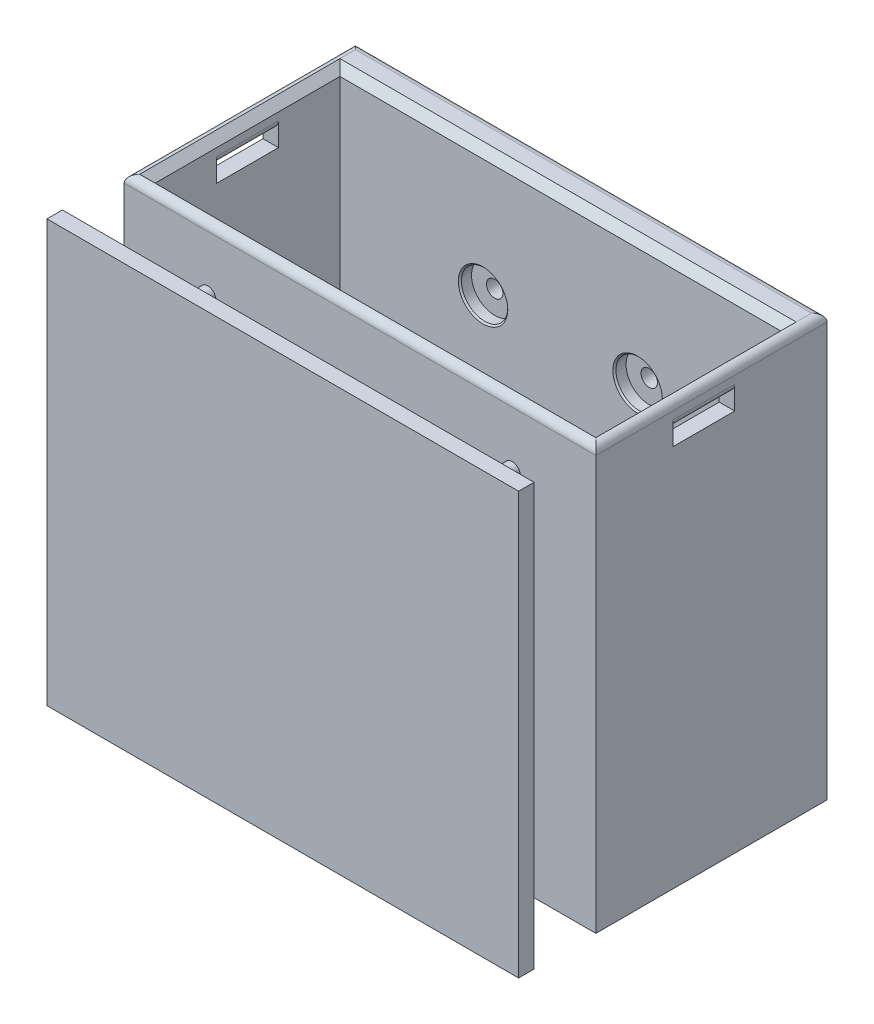
from build123d import *

# Parameters (mm, degrees)
SKETCH2_W                               = 193.802
SKETCH2_H                               = 94.996
BOSS_EXTRUDE1_DEPTH                     = 6.35
BOSS_EXTRUDE2_START                     = 6.35
SKETCH2_3_W                             = 193.802
SKETCH2_3_H                             = 94.996
SKETCH2_3_W_2                           = 181.102
SKETCH2_3_H_2                           = 75.946
BOSS_EXTRUDE2_DEPTH                     = 166.878
CBORE_FOR_1_4_HEX_HEAD_BOLT2_AT_2_COUNT = 2
CBORE_FOR_1_4_HEX_HEAD_BOLT2_AT_2_PITCH = 63.5
CBORE_FOR_1_4_HEX_HEAD_BOLT2_AT_3_COUNT = 2
CBORE_FOR_1_4_HEX_HEAD_BOLT2_AT_3_PITCH = 89.802561211
CBORE_FOR_1_4_HEX_HEAD_BOLT2_AT_4_COUNT = 2
CBORE_FOR_1_4_HEX_HEAD_BOLT2_AT_4_PITCH = 63.5
SKETCH12_R                              = 3.302
BOSS_EXTRUDE3_DEPTH                     = 25.4
BOSS_EXTRUDE3_2_DEPTH                   = 25.4
BOSS_EXTRUDE3_3_DEPTH                   = 25.4
BOSS_EXTRUDE3_4_DEPTH                   = 25.4
BOSS_EXTRUDE4_START                     = 25.4
SKETCH13_W                              = 193.802
SKETCH13_H                              = 173.228
BOSS_EXTRUDE4_DEPTH                     = 6.35
SKETCH16_W                              = 25.4
SKETCH16_H                              = 6.35
CUT_EXTRUDE2_DEPTH                      = 271.839909387
FILLET1_R                               = 3.175
FILLET2_R                               = 3.175
CHAMFER1_SIZE                           = 3.175


with BuildPart() as part:
    # Sketch2 → Boss-Extrude1 (new body)
    with BuildSketch(Plane(origin=(0, 0, 0), x_dir=(1, 0, 0), z_dir=(0, 1, 0))):
        with Locations((0, 3.175)):
            Rectangle(SKETCH2_W, SKETCH2_H)
    extrude(amount=BOSS_EXTRUDE1_DEPTH)

    # Sketch2<3> → Boss-Extrude2 (add)
    with BuildSketch(Plane(origin=(0, 0, 0), x_dir=(1, 0, 0), z_dir=(0, 1, 0)).offset(BOSS_EXTRUDE2_START)):
        with Locations((0, 3.175)):
            Rectangle(SKETCH2_3_W, SKETCH2_3_H)
        Rectangle(SKETCH2_3_W_2, SKETCH2_3_H_2, mode=Mode.SUBTRACT)
    extrude(amount=BOSS_EXTRUDE2_DEPTH)

    # Sketch8 → CBORE for 1/4 Hex Head Bolt2 (revolve, cut)
    with BuildSketch(Plane(origin=(-31.75, 121.539, -37.973), x_dir=(0, -1, 0), z_dir=(1, 0, 0))):
        Polygon((0, 0), (0, 12.7), (3.3782, 12.7), (3.3782, 4.7752), (9.525, 4.7752), (9.525, 0.635), (10.16, 0), align=None)
    cbore_for_1_4_hex_head_bolt2 = revolve(axis=Axis((-31.75, 121.539, -31.623), (0, 0, -1)), mode=Mode.SUBTRACT)

    # CBORE for 1/4 Hex Head Bolt2 at 2: CBORE for 1/4 Hex Head Bolt2 ×2
    with Locations(*[(i * CBORE_FOR_1_4_HEX_HEAD_BOLT2_AT_2_PITCH, 0, 0) for i in range(1, CBORE_FOR_1_4_HEX_HEAD_BOLT2_AT_2_COUNT)]):
        add(cbore_for_1_4_hex_head_bolt2, mode=Mode.SUBTRACT)

    # CBORE for 1/4 Hex Head Bolt2 at 3: CBORE for 1/4 Hex Head Bolt2 ×2
    with Locations(*[Vector(0.7071067811865476, -0.7071067811865475, 0) * (i * CBORE_FOR_1_4_HEX_HEAD_BOLT2_AT_3_PITCH) for i in range(1, CBORE_FOR_1_4_HEX_HEAD_BOLT2_AT_3_COUNT)]):
        add(cbore_for_1_4_hex_head_bolt2, mode=Mode.SUBTRACT)

    # CBORE for 1/4 Hex Head Bolt2 at 4: CBORE for 1/4 Hex Head Bolt2 ×2
    with Locations(*[(0, -i * CBORE_FOR_1_4_HEX_HEAD_BOLT2_AT_4_PITCH, 0) for i in range(1, CBORE_FOR_1_4_HEX_HEAD_BOLT2_AT_4_COUNT)]):
        add(cbore_for_1_4_hex_head_bolt2, mode=Mode.SUBTRACT)

    # Sketch16 → Cut-Extrude2 (cut, through all)
    with BuildSketch(Plane(origin=(96.901, 0, 0), x_dir=(0, 0, -1), z_dir=(1, 0, 0))):
        with Locations((0, 160.528)):
            Rectangle(SKETCH16_W, SKETCH16_H)
    extrude(amount=-CUT_EXTRUDE2_DEPTH, mode=Mode.SUBTRACT)

    # Fillet1
    fillet1_edges = [part.edges().sort_by_distance(p)[0] for p in [
        (90.551, 163.703, 0),
        (96.901, 163.703, 0),
        (-90.551, 163.703, 0),
        (-96.901, 163.703, 0),
    ]]
    fillet(fillet1_edges, radius=FILLET1_R - 0.0001)  # a hair under: the kernel refuses the full size

    # Fillet2
    fillet2_edges = [part.edges().sort_by_distance(p)[0] for p in [
        (0, 173.228, -50.673),
        (-96.901, 173.228, -3.175),
        (0, 173.228, 44.323),
        (96.901, 173.228, -3.175),
    ]]
    fillet(fillet2_edges, radius=FILLET2_R)

    # Chamfer1
    chamfer1_edges = [part.edges().sort_by_distance(p)[0] for p in [
        (-90.551, 173.228, 0),
        (0, 173.228, -37.973),
        (90.551, 173.228, 0),
        (0, 173.228, 37.973),
    ]]
    chamfer(chamfer1_edges, length=CHAMFER1_SIZE - 0.0001)  # a hair under: the kernel refuses the full size


with BuildPart() as body_2:
    # Sketch12 → Boss-Extrude3 (new body)
    with BuildSketch(Plane.XY.offset(44.323)):
        with Locations((-62.532400681, 147.410019982)):
            Circle(SKETCH12_R)
    extrude(amount=BOSS_EXTRUDE3_DEPTH)


with BuildPart() as body_3:
    # Sketch12 → Boss-Extrude3 2 (new body)
    with BuildSketch(Plane.XY.offset(44.323)):
        with Locations((62.532400681, 147.410019982)):
            Circle(SKETCH12_R)
    extrude(amount=BOSS_EXTRUDE3_2_DEPTH)


with BuildPart() as body_4:
    # Sketch12 → Boss-Extrude3 3 (new body)
    with BuildSketch(Plane.XY.offset(44.323)):
        with Locations((62.532400681, 32.167980018)):
            Circle(SKETCH12_R)
    extrude(amount=BOSS_EXTRUDE3_3_DEPTH)


with BuildPart() as body_5:
    # Sketch12 → Boss-Extrude3 4 (new body)
    with BuildSketch(Plane.XY.offset(44.323)):
        with Locations((-62.532400681, 32.167980018)):
            Circle(SKETCH12_R)
    extrude(amount=BOSS_EXTRUDE3_4_DEPTH)


with BuildPart() as body_6:
    # Sketch13 → Boss-Extrude4 (new body)
    with BuildSketch(Plane.XY.offset(44.323).offset(BOSS_EXTRUDE4_START)):
        with Locations((0, 86.614)):
            Rectangle(SKETCH13_W, SKETCH13_H)
    extrude(amount=BOSS_EXTRUDE4_DEPTH)


solid = Compound([part.part, body_2.part, body_3.part, body_4.part, body_5.part, body_6.part])
